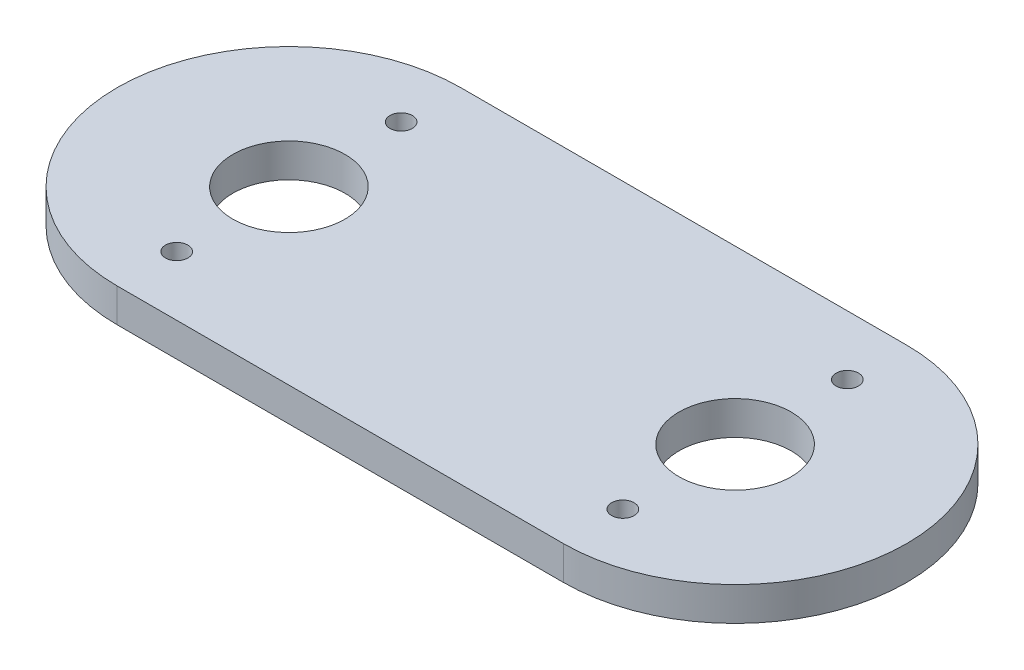
from build123d import *

# Parameters (mm, degrees)
BOSS_EXTRUDE1_DEPTH = 3
SKETCH2_R           = 5
SKETCH2_R_2         = 1
CUT_EXTRUDE1_DEPTH  = 57.401986652


with BuildPart() as part:
    # Sketch1 → Boss-Extrude1 (new body)
    with BuildSketch(Plane(origin=(0, 0, 0), x_dir=(1, 0, 0), z_dir=(0, 1, 0))):
        with BuildLine():
            Line((-31.972318339, 0), (7.785985851, 0))
            ThreePointArc((7.785985851, 0), (23.091295391, -15.30530954), (7.785985851, -30.61061908))
            Line((7.785985851, -30.61061908), (-31.972318339, -30.61061908))
            ThreePointArc((-31.972318339, -30.61061908), (-47.277627879, -15.30530954), (-31.972318339, 0))
        make_face()
    extrude(amount=BOSS_EXTRUDE1_DEPTH)

    # Sketch2 → Cut-Extrude1 (cut, through all)
    with BuildSketch(Plane(origin=(0, 3, 0), x_dir=(1, 0, 0), z_dir=(0, 1, 0))):
        with Locations((-31.972318339, -15.30530954)):
            Circle(SKETCH2_R)
        with Locations((-31.972318339, -5.30530954)):
            Circle(SKETCH2_R_2)
        with Locations((-31.972318339, -25.30530954)):
            Circle(SKETCH2_R_2)
        with Locations((7.785985851, -5.30530954)):
            Circle(SKETCH2_R_2)
        with Locations((7.785985851, -15.30530954)):
            Circle(SKETCH2_R)
        with Locations((7.785985851, -25.30530954)):
            Circle(SKETCH2_R_2)
    extrude(amount=-CUT_EXTRUDE1_DEPTH, mode=Mode.SUBTRACT)


solid = part.part
